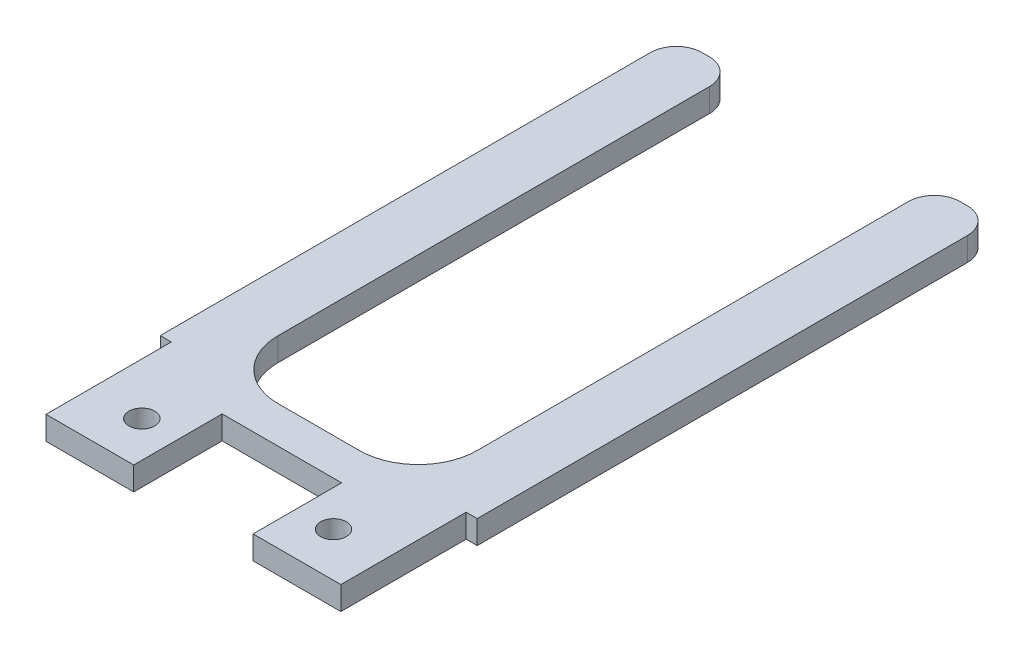
from build123d import *

# Parameters (mm, degrees)
CROQUIS1_R              = 1.75
SALIENTE_EXTRUIR1_DEPTH = 1.5875
REDONDEO1_R             = 8


with BuildPart() as part:
    # Croquis1 → Saliente-Extruir1 (new, symmetric)
    with BuildSketch(Plane(origin=(0, 0, 0), x_dir=(1, 0, 0), z_dir=(0, 1, 0))):
        with BuildLine():
            Line((8.1, 0), (8.1, -12))
            Line((8.1, -12), (20, -12))
            Line((20, -12), (20, 5))
            Line((20, 5), (21.5, 5))
            Line((21.5, 5), (21.5, 71.5))
            ThreePointArc((21.5, 71.5), (20.474873734, 73.974873734), (18, 75))
            Line((18, 75), (17, 75))
            ThreePointArc((17, 75), (14.525126266, 73.974873734), (13.5, 71.5))
            Line((13.5, 71.5), (13.5, 5))
            Line((13.5, 5), (-13.5, 5))
            Line((-13.5, 5), (-13.5, 71.5))
            ThreePointArc((-13.5, 71.5), (-14.525126266, 73.974873734), (-17, 75))
            Line((-17, 75), (-18, 75))
            ThreePointArc((-18, 75), (-20.474873734, 73.974873734), (-21.5, 71.5))
            Line((-21.5, 71.5), (-21.5, 5))
            Line((-21.5, 5), (-20, 5))
            Line((-20, 5), (-20, -12))
            Line((-20, -12), (-8.1, -12))
            Line((-8.1, -12), (-8.1, 0))
            Line((-8.1, 0), (8.1, 0))
        make_face()
        with Locations((13, -6)):
            Circle(CROQUIS1_R, mode=Mode.SUBTRACT)
        with Locations((-13, -6)):
            Circle(CROQUIS1_R, mode=Mode.SUBTRACT)
    extrude(amount=SALIENTE_EXTRUIR1_DEPTH, both=True)

    # Redondeo1
    redondeo1_edges = [part.edges().sort_by_distance(p)[0] for p in [
        (13.5, 0, -5),
        (-13.5, 0, -5),
    ]]
    fillet(redondeo1_edges, radius=REDONDEO1_R)


solid = part.part
